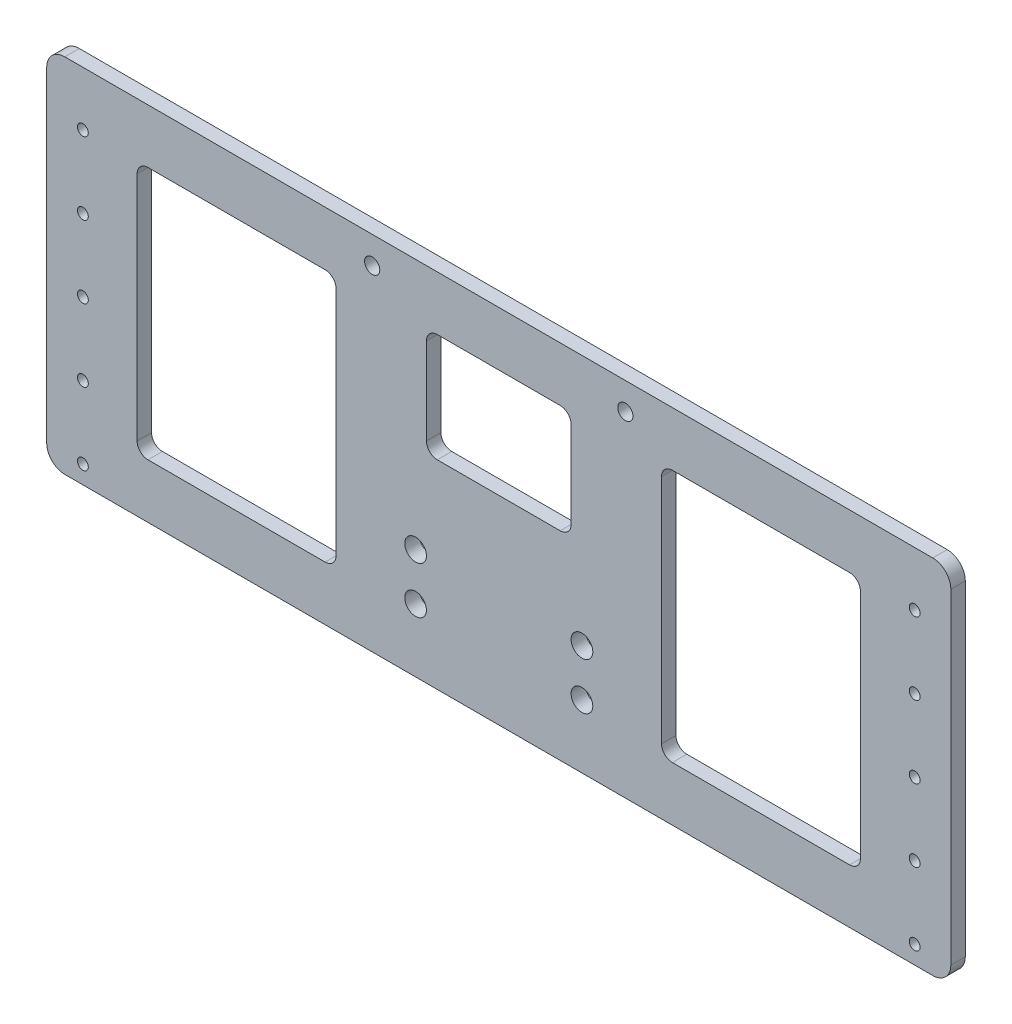
from build123d import *

# Parameters (mm, degrees)
SKETCH_1_W          = 250
SKETCH_1_H          = 30
SKETCH_1_R          = 1.5
EXTRUDE_1_DEPTH     = 4
SKETCH_2_R          = 3
CUT_EXTRUDE_1_DEPTH = 126.96031121
SKETCH_3_R          = 1.5
SKETCH_3_R_2        = 2.1
EXTRUDE_2_DEPTH     = 4
CUT_EXTRUDE_2_DEPTH = 152.215078613
FILLET_1_R          = 5
SKETCH_5_R          = 3
CUT_EXTRUDE_3_DEPTH = 152.215078613


with BuildPart() as part:
    # 草图1 → 凸台-拉伸1 (new body)
    with BuildSketch(Plane.XY):
        Rectangle(SKETCH_1_W, SKETCH_1_H)
        with Locations((-115, -10)):
            Circle(SKETCH_1_R, mode=Mode.SUBTRACT)
        with Locations((-115, 10)):
            Circle(SKETCH_1_R, mode=Mode.SUBTRACT)
        with Locations((115, 10)):
            Circle(SKETCH_1_R, mode=Mode.SUBTRACT)
        with Locations((115, -10)):
            Circle(SKETCH_1_R, mode=Mode.SUBTRACT)
    extrude(amount=EXTRUDE_1_DEPTH)

    # 草图2 → 切除-拉伸1 (cut, through all)
    with BuildSketch(Plane.XY.offset(4)):
        with Locations((-23, 2.5)):
            Circle(SKETCH_2_R)
        with Locations((23, 2.5)):
            Circle(SKETCH_2_R)
        with Locations((23, 15.5)):
            Circle(SKETCH_2_R)
        with Locations((-23, 15.5)):
            Circle(SKETCH_2_R)
    extrude(amount=-CUT_EXTRUDE_1_DEPTH, mode=Mode.SUBTRACT)

    # 草图3 → 凸台-拉伸2 (add)
    with BuildSketch(Plane.XY.offset(4)):
        Polygon((125, 85), (-125, 85), (-125, 15), (25.958039892, 15), (125, 15), align=None)
        with Locations((-115, 30)):
            Circle(SKETCH_3_R, mode=Mode.SUBTRACT)
        with Locations((115, 30)):
            Circle(SKETCH_3_R, mode=Mode.SUBTRACT)
        with Locations((-115, 50)):
            Circle(SKETCH_3_R, mode=Mode.SUBTRACT)
        with Locations((-115, 70)):
            Circle(SKETCH_3_R, mode=Mode.SUBTRACT)
        with Locations((-35, 77.5)):
            Circle(SKETCH_3_R_2, mode=Mode.SUBTRACT)
        with Locations((115, 50)):
            Circle(SKETCH_3_R, mode=Mode.SUBTRACT)
        with Locations((115, 70)):
            Circle(SKETCH_3_R, mode=Mode.SUBTRACT)
        with Locations((35, 77.5)):
            Circle(SKETCH_3_R_2, mode=Mode.SUBTRACT)
    extrude(amount=-EXTRUDE_2_DEPTH)

    # 草图4 → 切除-拉伸2 (cut, through all)
    with BuildSketch(Plane.XY.offset(4)):
        with BuildLine():
            Line((-17, 70), (17, 70))
            ThreePointArc((17, 70), (19.121320344, 69.121320344), (20, 67))
            Line((20, 67), (20, 43))
            ThreePointArc((20, 43), (19.121320344, 40.878679656), (17, 40))
            Line((17, 40), (-17, 40))
            ThreePointArc((-17, 40), (-19.121320344, 40.878679656), (-20, 43))
            Line((-20, 43), (-20, 67))
            ThreePointArc((-20, 67), (-19.121320344, 69.121320344), (-17, 70))
        make_face()
        with BuildLine():
            Line((-97, 70), (-48, 70))
            ThreePointArc((-48, 70), (-45.878679656, 69.121320344), (-45, 67))
            Line((-45, 67), (-45, 3))
            ThreePointArc((-45, 3), (-45.878679656, 0.878679656), (-48, 0))
            Line((-48, 0), (-97, 0))
            ThreePointArc((-97, 0), (-99.121320344, 0.878679656), (-100, 3))
            Line((-100, 3), (-100, 67))
            ThreePointArc((-100, 67), (-99.121320344, 69.121320344), (-97, 70))
        make_face()
        with BuildLine():
            Line((97, 0), (48, 0))
            ThreePointArc((48, 0), (45.878679656, 0.878679656), (45, 3))
            Line((45, 3), (45, 67))
            ThreePointArc((45, 67), (45.878679656, 69.121320344), (48, 70))
            Line((48, 70), (97, 70))
            ThreePointArc((97, 70), (99.121320344, 69.121320344), (100, 67))
            Line((100, 67), (100, 3))
            ThreePointArc((100, 3), (99.121320344, 0.878679656), (97, 0))
        make_face()
    extrude(amount=-CUT_EXTRUDE_2_DEPTH, mode=Mode.SUBTRACT)

    # 圆角1
    fillet_1_edges = [part.edges().sort_by_distance(p)[0] for p in [
        (125, -15, 2),
        (125, 85, 2),
        (-125, -15, 2),
        (-125, 85, 2),
    ]]
    fillet(fillet_1_edges, radius=FILLET_1_R)

    # 草图5 → 切除-拉伸3 (cut, through all)
    with BuildSketch(Plane.XY.offset(4)):
        with Locations((-23, 15.5)):
            Circle(SKETCH_5_R)
        with Locations((23, 15.5)):
            Circle(SKETCH_5_R)
    extrude(amount=-CUT_EXTRUDE_3_DEPTH, mode=Mode.SUBTRACT)


solid = part.part
